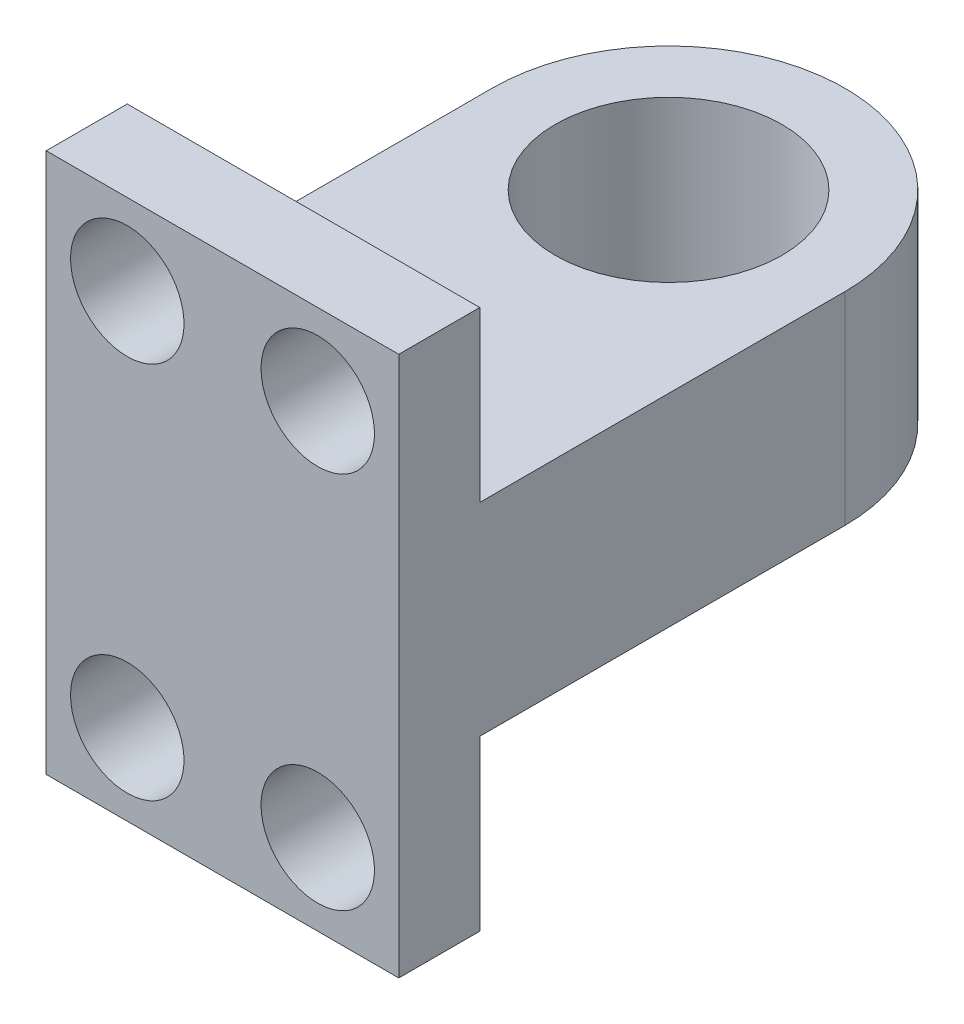
from build123d import *

# Parameters (mm, degrees)
SKETCH1_R                   = 4.2
BOSS_EXTRUDE1_DEPTH         = 7.5
SKETCH2_W                   = 13.052813899
SKETCH2_H                   = 20
BOSS_EXTRUDE2_DEPTH         = 3
TAP_DRILL_FOR_M5X0_8_TAP1_D = 4.2


with BuildPart() as part:
    # Sketch1 → Boss-Extrude1 (new body)
    with BuildSketch(Plane(origin=(0, 0, 0), x_dir=(1, 0, 0), z_dir=(0, 1, 0))):
        with BuildLine():
            Line((-13.052813899, 0), (0, 0))
            Line((0, 0), (0, 13.515965543))
            ThreePointArc((0, 13.515965543), (-6.526406943, 20.042372492), (-13.052813899, 13.515965556))
            Line((-13.052813899, 13.515965556), (-13.052813899, 0))
        make_face()
        with Locations((-6.526406949, 13.515965543)):
            Circle(SKETCH1_R, mode=Mode.SUBTRACT)
    extrude(amount=BOSS_EXTRUDE1_DEPTH)

    # Sketch2 → Boss-Extrude2 (add)
    with BuildSketch(Plane.XY):
        with Locations((-6.52640695, 3.75)):
            Rectangle(SKETCH2_W, SKETCH2_H)
    extrude(amount=BOSS_EXTRUDE2_DEPTH)

    # Tap Drill for M5x0.8 Tap1 (through all)
    with Locations(Plane(origin=(-3, 10.75, 0), x_dir=(-1, 0, 0), z_dir=(0, 0, -1))):
        with Locations((0, 0), (7.052813899, 0), (0, -14), (7.052813899, -14)):
            Hole(TAP_DRILL_FOR_M5X0_8_TAP1_D / 2)


solid = part.part
